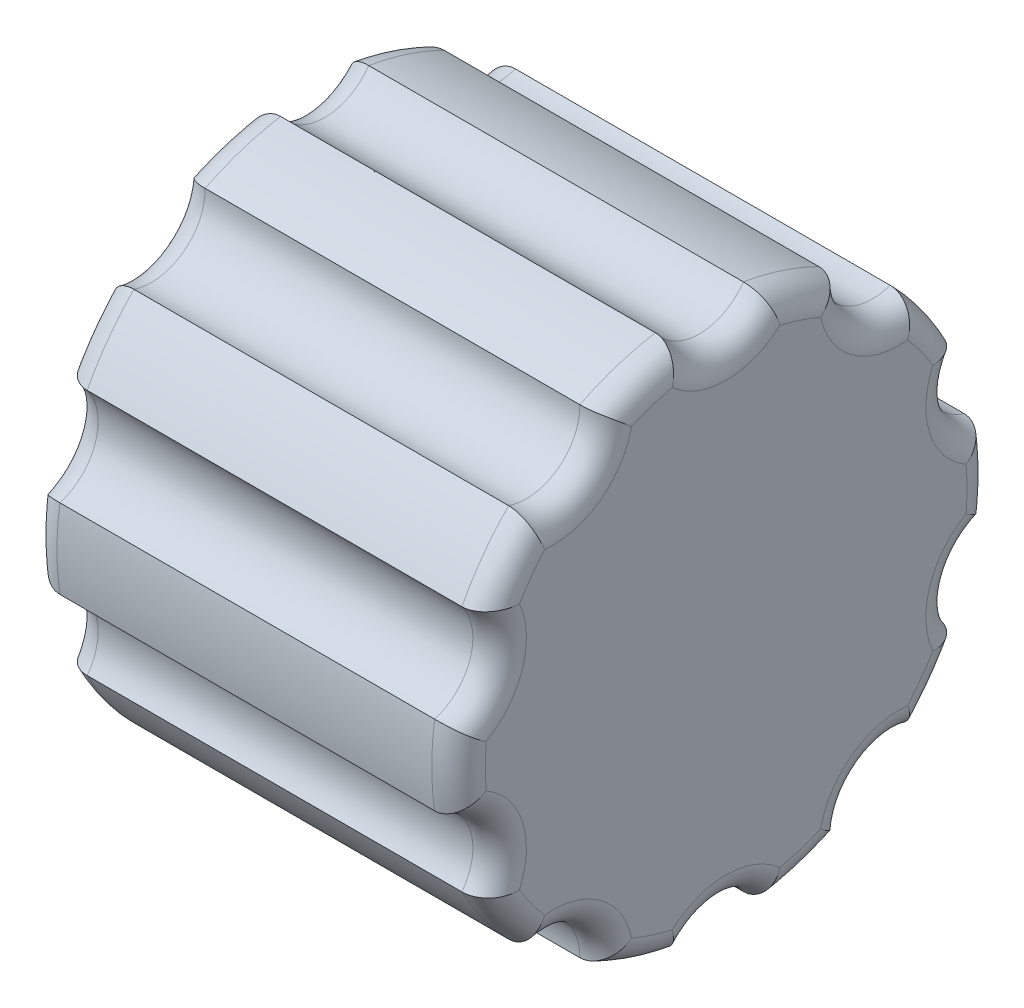
from build123d import *

# Parameters (mm, degrees)
BOSS_EXTRUDE1_DEPTH = 8
FILLET1_R           = 0.5
SKETCH3_R           = 2.75
CUT_EXTRUDE1_DEPTH  = 3.2
CUT_EXTRUDE3_DEPTH  = 1.6


with BuildPart() as part:
    # Sketch1 → Boss-Extrude1 (new body)
    with BuildSketch(Plane(origin=(0, 0, 0), x_dir=(0, 0, -1), z_dir=(1, 0, 0))):
        with BuildLine():
            ThreePointArc((4.944728844632244, -0.7413883281127849), (4.986163065081267, -0.3717228650747642), (5, -1.22e-15))
            ThreePointArc((5, 0), (4.986163065081267, 0.3717228650747603), (4.944728844632245, 0.7413883281127829))
            ThreePointArc((4.944728844632245, 0.7413883281127829), (4.279754323328191, 1.3905764746872642), (4.436146793369953, 2.306642934585563))
            ThreePointArc((4.436146793369952, 2.3066429345855624), (4.045084971874736, 2.9389262614623664), (3.5645925423970177, 3.5062344483345043))
            ThreePointArc((3.564592542397018, 3.5062344483345047), (2.6450336353161292, 3.640576474687263), (2.2331074461241944, 4.473614996182023))
            ThreePointArc((2.2331074461241944, 4.473614996182023), (1.5450849718747373, 4.755282581475767), (0.8229030450105304, 4.931818181818182))
            ThreePointArc((0.8229030450105309, 4.931818181818182), (-1.1e-16, 4.5), (-0.822903045010531, 4.931818181818182))
            ThreePointArc((-0.822903045010531, 4.931818181818182), (-1.545084971874739, 4.755282581475767), (-2.2331074461241966, 4.473614996182022))
            ThreePointArc((-2.2331074461241958, 4.473614996182022), (-2.64503363531613, 3.640576474687262), (-3.564592542397019, 3.506234448334503))
            ThreePointArc((-3.5645925423970186, 3.506234448334503), (-4.045084971874736, 2.9389262614623664), (-4.436146793369952, 2.306642934585562))
            ThreePointArc((-4.436146793369953, 2.3066429345855606), (-4.2797543233281905, 1.3905764746872618), (-4.944728844632245, 0.7413883281127813))
            ThreePointArc((-4.944728844632245, 0.7413883281127821), (-5, 6.1e-16), (-4.944728844632245, -0.7413883281127831))
            ThreePointArc((-4.944728844632245, -0.7413883281127835), (-4.2797543233281905, -1.3905764746872635), (-4.436146793369951, -2.3066429345855624))
            ThreePointArc((-4.436146793369952, -2.306642934585563), (-4.045084971874738, -2.938926261462365), (-3.5645925423970177, -3.5062344483345043))
            ThreePointArc((-3.564592542397018, -3.506234448334505), (-2.6450336353161292, -3.6405764746872635), (-2.233107446124194, -4.473614996182023))
            ThreePointArc((-2.2331074461241958, -4.473614996182022), (-1.5450849718747377, -4.755282581475767), (-0.822903045010531, -4.931818181818182))
            ThreePointArc((-0.8229030450105302, -4.931818181818182), (7.8e-16, -4.5), (0.8229030450105317, -4.931818181818182))
            ThreePointArc((0.8229030450105291, -4.9318181818181825), (1.5450849718747361, -4.755282581475768), (2.233107446124194, -4.473614996182023))
            ThreePointArc((2.2331074461241944, -4.473614996182022), (2.6450336353161297, -3.640576474687263), (3.5645925423970186, -3.506234448334504))
            ThreePointArc((3.5645925423970164, -3.5062344483345056), (4.045084971874736, -2.938926261462367), (4.436146793369952, -2.3066429345855624))
            ThreePointArc((4.436146793369953, -2.3066429345855615), (4.279754323328191, -1.3905764746872626), (4.944728844632245, -0.741388328112782))
        make_face()
    extrude(amount=BOSS_EXTRUDE1_DEPTH)

    # Fillet1
    fillet1_edges = [part.edges().sort_by_distance(p)[0] for p in [
        (8, 1.3905764746872618, 4.2797543233281905),
        (8, -6.4e-16, 5),
        (0, 4.755282581475768, 1.545084971874739),
        (0, 4.5, 1.1e-16),
        (0, 4.755282581475767, -1.5450849718747368),
        (8, -1.3905764746872635, 4.2797543233281905),
        (0, 3.640576474687263, -2.645033635316129),
        (0, 2.938926261462365, -4.045084971874736),
        (0, 1.390576474687264, -4.279754323328191),
        (0, -4.9e-16, -5),
        (0, -1.3905764746872629, -4.279754323328191),
        (0, -2.938926261462367, -4.045084971874737),
        (0, -3.640576474687263, -2.64503363531613),
        (0, -4.755282581475768, -1.5450849718747364),
        (8, -2.938926261462366, 4.045084971874737),
        (0, -4.5, -7.8e-16),
        (0, -4.755282581475768, 1.5450849718747377),
        (0, -3.6405764746872635, 2.6450336353161292),
        (0, -2.938926261462366, 4.045084971874737),
        (0, -1.3905764746872635, 4.2797543233281905),
        (0, -6.4e-16, 5),
        (8, -3.6405764746872635, 2.6450336353161292),
        (0, 1.3905764746872618, 4.2797543233281905),
        (0, 2.9389262614623646, 4.045084971874736),
        (0, 3.640576474687262, 2.64503363531613),
        (8, -4.755282581475768, 1.5450849718747377),
        (8, -4.5, -7.8e-16),
        (8, -4.755282581475768, -1.5450849718747364),
        (8, -3.640576474687263, -2.64503363531613),
        (8, -2.938926261462367, -4.045084971874737),
        (8, -1.3905764746872629, -4.279754323328191),
        (8, 3.640576474687262, 2.64503363531613),
        (8, -1.4e-16, -5),
        (8, 1.390576474687264, -4.279754323328191),
        (8, 2.938926261462365, -4.045084971874736),
        (8, 3.640576474687263, -2.645033635316129),
        (8, 4.755282581475767, -1.5450849718747368),
        (8, 4.5, 1.1e-16),
        (8, 4.755282581475768, 1.545084971874739),
        (8, 2.9389262614623646, 4.045084971874736),
    ]]
    fillet(fillet1_edges, radius=FILLET1_R - 0.0001)  # a hair under: the kernel refuses the full size

    # Sketch3 → Cut-Extrude1 (cut)
    with BuildSketch(Plane.ZY):
        Circle(SKETCH3_R)
        Polygon((0.7505553499465136, -1.3000000000000003), (1.501110699893027, 6.5e-16), (0.7505553499465132, 1.3000000000000003), (-0.7505553499465136, 1.3000000000000003), (-1.5011106998930273, -2.1e-16), (-0.7505553499465139, -1.3000000000000003), align=None, mode=Mode.SUBTRACT)
    extrude(amount=-CUT_EXTRUDE1_DEPTH, mode=Mode.SUBTRACT)

    # Sketch3<7> → Cut-Extrude3 (cut)
    with BuildSketch(Plane.ZY):
        Polygon((1.501110699893027, 6.5e-16), (0.7505553499465132, 1.3000000000000003), (-0.7505553499465136, 1.3000000000000003), (-1.5011106998930273, -2.1e-16), (-0.7505553499465139, -1.3000000000000003), (0.7505553499465136, -1.3000000000000003), align=None)
    extrude(amount=-CUT_EXTRUDE3_DEPTH, mode=Mode.SUBTRACT)


solid = part.part
